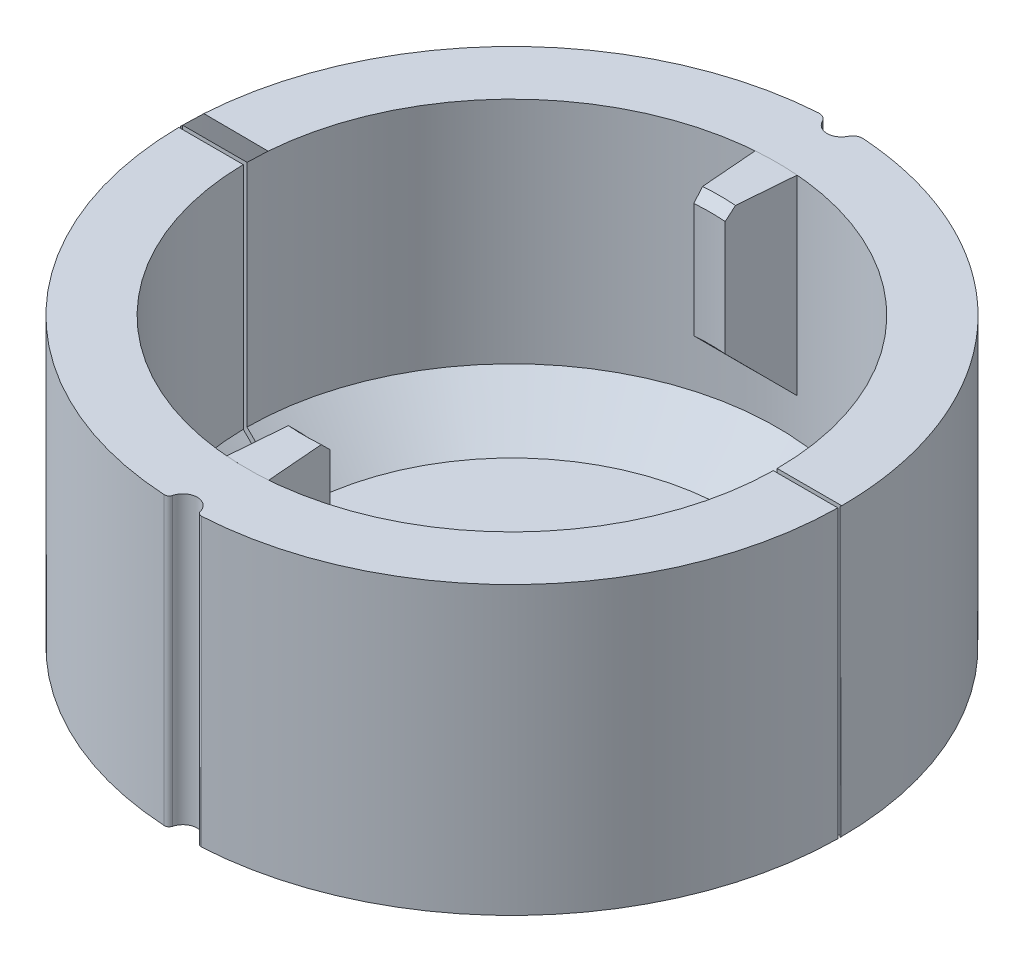
from build123d import *

# Parameters (mm, degrees)
BOSS_EXTRUDE1_DEPTH = 30
CUT_EXTRUDE2_REACH  = 60.241
CUT_EXTRUDE2_START  = 1
SKETCH2_R           = 27.75
BOSS_EXTRUDE2_START = 10
BOSS_EXTRUDE2_DEPTH = 20
CHAMFER2_SIZE       = 1
CHAMFER3_SIZE       = 7
CIRPATTERN2_COUNT   = 2
FILLET2_SIZE        = 5
SKETCH14_W          = 68.999057692
SKETCH14_H          = 0.4
CUT_EXTRUDE4_DEPTH  = 58.241242639


with BuildPart() as part:
    # Sketch1 → Boss-Extrude1 (new body)
    with BuildSketch(Plane(origin=(0, 0, 0), x_dir=(1, 0, 0), z_dir=(0, 1, 0))):
        with BuildLine():
            ThreePointArc((1.451818925, -34.068556857), (1.641248992, -34.346908706), (1.964225605, -34.442038138))
            ThreePointArc((1.964225605, -34.442038138), (34.499528846, -0.178302888), (2.324135821, 34.423627607))
            ThreePointArc((2.324135821, 34.423627607), (1.751838249, 34.289058819), (1.354061739, 33.856153382))
            ThreePointArc((1.354061739, 33.856153382), (0, 33.001534515), (-1.354061739, 33.856153382))
            ThreePointArc((-1.354061739, 33.856153382), (-1.751838249, 34.289058819), (-2.324135821, 34.423627607))
            ThreePointArc((-2.324135821, 34.423627607), (-34.499528846, -0.178302888), (-1.964225605, -34.442038138))
            ThreePointArc((-1.964225605, -34.442038138), (-1.641248992, -34.346908706), (-1.451818925, -34.068556857))
            ThreePointArc((-1.451818925, -34.068556857), (0, -32.945679925), (1.451818925, -34.068556857))
        make_face()
    extrude(amount=BOSS_EXTRUDE1_DEPTH)

    # Sketch2 → Cut-Extrude2 (cut, up to next)
    with BuildSketch(Plane(origin=(0, 0, 0), x_dir=(1, 0, 0), z_dir=(0, 1, 0)).offset(CUT_EXTRUDE2_START), mode=Mode.PRIVATE) as cut_extrude2_sk1:
        with Locations(Location((0, 0, 0), (0, 0, 270))):
            Circle(SKETCH2_R)
    cut_extrude2_tool1 = extrude(cut_extrude2_sk1.sketch, amount=CUT_EXTRUDE2_REACH, mode=Mode.PRIVATE) & part.part
    add(cut_extrude2_tool1.solids().sort_by_distance((0, 1, 0))[0], mode=Mode.SUBTRACT)

    # Fillet2
    fillet2_edges = [part.edges().sort_by_distance(p)[0] for p in [
        (0, 1, -27.75),
    ]]
    chamfer(fillet2_edges, length=FILLET2_SIZE)

    # Sketch14 → Cut-Extrude4 (cut, through all)
    with BuildSketch(Plane(origin=(0, 30, 0), x_dir=(1, 0, 0), z_dir=(0, 1, 0))):
        with Locations((0, -0.178302888)):
            Rectangle(SKETCH14_W, SKETCH14_H)
    extrude(amount=-CUT_EXTRUDE4_DEPTH, mode=Mode.SUBTRACT)


with BuildPart() as body_2:
    # Sketch2<2> → Boss-Extrude2 (new body)
    with BuildSketch(Plane(origin=(0, 0, 0), x_dir=(1, 0, 0), z_dir=(0, 1, 0)).offset(BOSS_EXTRUDE2_START)):
        with BuildLine():
            ThreePointArc((2.198270889, 27.662792793), (0, 27.75), (-2.198270889, 27.662792793))
            Line((-2.198270889, 27.662792793), (-1.643752106, 20.684791007))
            ThreePointArc((-1.643752106, 20.684791007), (0, 20.75), (1.643752106, 20.684791007))
            Line((1.643752106, 20.684791007), (2.198270889, 27.662792793))
        make_face()
    extrude(amount=BOSS_EXTRUDE2_DEPTH)

    # Chamfer2
    chamfer2_edges = [body_2.edges().sort_by_distance(p)[0] for p in [
        (0, 30, -20.75),
    ]]
    chamfer(chamfer2_edges, length=CHAMFER2_SIZE)

    # Chamfer3
    chamfer3_edges = [body_2.edges().sort_by_distance(p)[0] for p in [
        (0, 10, -20.75),
    ]]
    chamfer(chamfer3_edges, length=CHAMFER3_SIZE - 0.0001)  # a hair under: the kernel refuses the full size


with BuildPart() as cirpattern2_1:
    # CirPattern2: pattern copy
    add(body_2.part.rotate(Axis((0, 0, 0), (0, 1, 0)), 1 * 360 / CIRPATTERN2_COUNT))


with BuildPart() as cut_extrude4_piece_1:
    # of the separate pieces the step leaves, piece 1, a body of its own (cut_extrude4_pieces)
    add(part.part.solids().sort_by_distance((27.749991518, 6, -0.021697112))[0])


with BuildPart() as cut_extrude4_piece_2:
    # of the separate pieces the step leaves, piece 2, a body of its own (cut_extrude4_pieces)
    add(part.part.solids().sort_by_distance((27.747421266, 6, 0.378302888))[0])


solid = Compound([body_2.part, cirpattern2_1.part, cut_extrude4_piece_1.part, cut_extrude4_piece_2.part])
